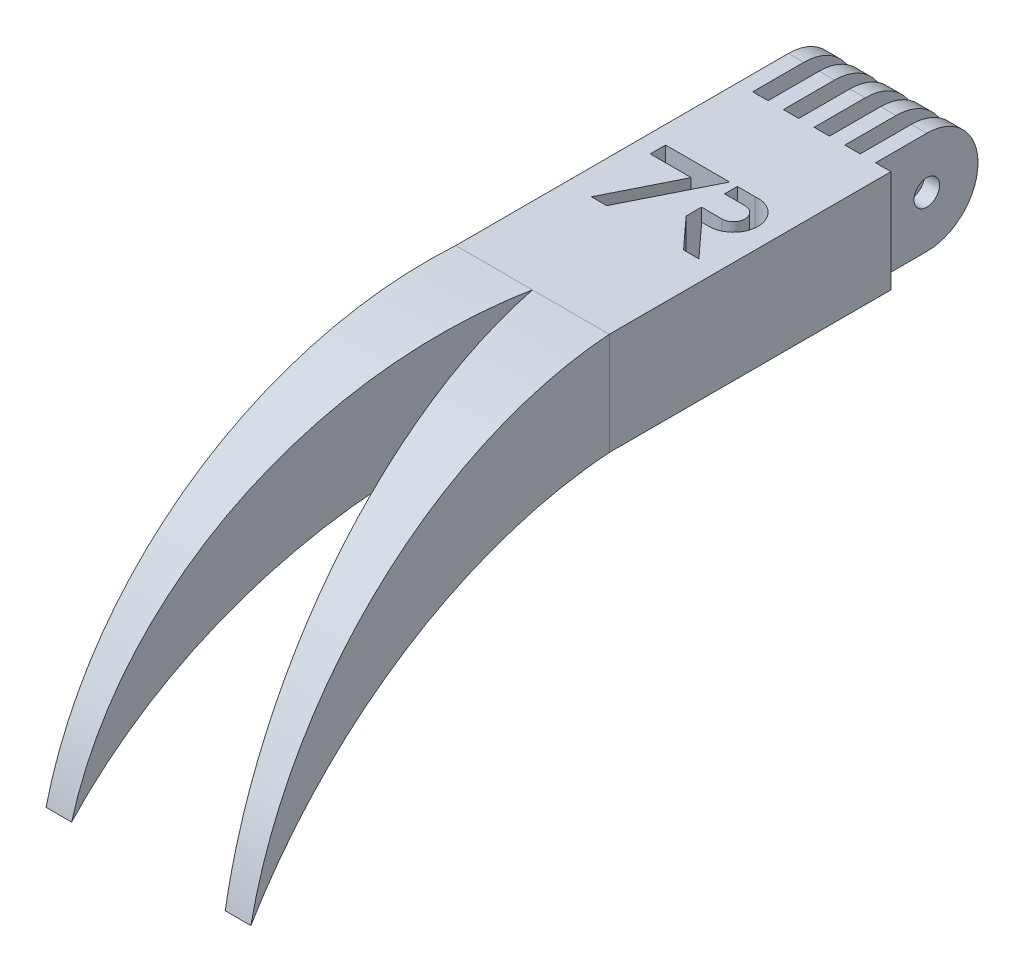
from build123d import *

# Parameters (mm, degrees)
ESQUISSE1_R             = 2.5
BOSS_EXTRU_1_DEPTH      = 40
ENL_V_MAT_EXTRU_1_DEPTH = 60
CONG_1_R                = 10
ENL_V_MAT_EXTRU_2_DEPTH = 20
ENL_V_MAT_EXTRU_3_DEPTH = 20


with BuildPart() as part:
    # Esquisse1 → Boss.-Extru.1 (new body)
    with BuildSketch(Plane(origin=(0, 0, 0), x_dir=(0, 0, -1), z_dir=(1, 0, 0))):
        with BuildLine():
            Line((0, 10), (75, 10))
            Line((75, 10), (75, 30))
            Line((75, 30), (0, 30))
            ThreePointArc((0, 30), (-48.023431781, 13.154289726), (-75, -30))
            ThreePointArc((-75, -30), (-42.5, -0.625), (0, 10))
        make_face()
        with Locations((65, 20)):
            Circle(ESQUISSE1_R, mode=Mode.SUBTRACT)
    extrude(amount=BOSS_EXTRU_1_DEPTH)

    # Esquisse2 → Enlèv. mat.-Extru.1 (cut)
    with BuildSketch(Plane(origin=(0, 30, 0), x_dir=(1, 0, 0), z_dir=(0, 1, 0))):
        Polygon((20, 0), (5, -75), (35, -75), align=None)
        Polygon((0, 75), (5, 75), (5, 0), (0, -75), align=None)
        Polygon((40, 75), (35, 75), (35, 0), (40, -75), align=None)
    extrude(amount=-ENL_V_MAT_EXTRU_1_DEPTH, mode=Mode.SUBTRACT)

    # Congé1
    cong_1_edges = [part.edges().sort_by_distance(p)[0] for p in [
        (20, 10, -75),
        (20, 30, -75),
    ]]
    fillet(cong_1_edges, radius=CONG_1_R - 0.0001)  # a hair under: the kernel refuses the full size

    # Esquisse3 → Enlèv. mat.-Extru.2 (cut)
    with BuildSketch(Plane(origin=(0, 30, 0), x_dir=(1, 0, 0), z_dir=(0, 1, 0))):
        Polygon((35, 82), (35, 55), (32, 55), (32, 80), (29, 80), (29, 55), (26, 55), (26, 80), (23, 80), (23, 55), (20, 55), (20, 80), (17, 80), (17, 55), (14, 55), (14, 80), (11, 80), (11, 55), (8, 55), (8, 82), align=None)
    extrude(amount=-ENL_V_MAT_EXTRU_2_DEPTH, mode=Mode.SUBTRACT)

    # Esquisse4 → Enlèv. mat.-Extru.3 (cut)
    with BuildSketch(Plane(origin=(0, 30, 0), x_dir=(1, 0, 0), z_dir=(0, 1, 0))):
        Polygon((8.5, 37.5), (8.5, 34.5), (16.5, 34.5), (10, 21.5), (13, 21.5), (21, 37.5), align=None)
        with BuildLine():
            Line((31, 21.5), (28, 21.5))
            Line((28, 21.5), (22.5, 27.5))
            Line((22.5, 27.5), (22.5, 30.5))
            Line((22.5, 30.5), (26.5, 30.5))
            ThreePointArc((26.5, 30.5), (28.75, 32.75), (26.5, 35))
            Line((26.5, 35), (22.5, 35))
            Line((22.5, 35), (22.5, 37.5))
            Line((22.5, 37.5), (26, 37.5))
            ThreePointArc((26, 37.5), (31.269677958, 33.000344118), (26.5, 27.973756706))
            Line((26.5, 27.973756706), (25.065723019, 27.973756706))
            Line((25.065723019, 27.973756706), (31, 21.5))
        make_face()
    extrude(amount=-ENL_V_MAT_EXTRU_3_DEPTH, mode=Mode.SUBTRACT)


solid = part.part
